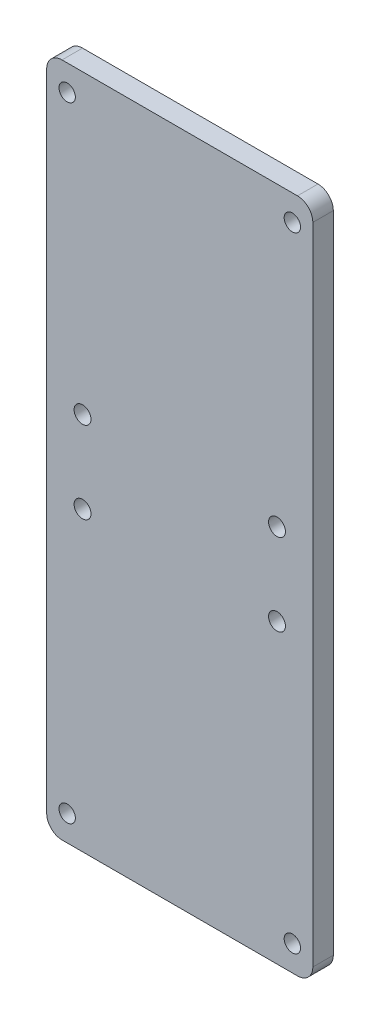
from build123d import *

# Parameters (mm, degrees)
SKETCH1_R           = 1.65
SKETCH1_R_2         = 1.6
BOSS_EXTRUDE1_DEPTH = 4


with BuildPart() as part:
    # Sketch1 → Boss-Extrude1 (new body)
    with BuildSketch(Plane.XY):
        with BuildLine():
            Line((23.206941284, 124.936391703), (23.206941284, -1.063608297))
            ThreePointArc((23.206941284, -1.063608297), (24.085620941, -3.184928641), (26.206941284, -4.063608297))
            Line((26.206941284, -4.063608297), (72.208519176, -4.063608297))
            ThreePointArc((72.208519176, -4.063608297), (74.32983952, -3.184928641), (75.208519176, -1.063608297))
            Line((75.208519176, -1.063608297), (75.208519176, 124.936391703))
            ThreePointArc((75.208519176, 124.936391703), (74.32983952, 127.057712046), (72.208519176, 127.936391703))
            Line((72.208519176, 127.936391703), (26.206941284, 127.936391703))
            ThreePointArc((26.206941284, 127.936391703), (24.085620941, 127.057712046), (23.206941284, 124.936391703))
        make_face()
        with Locations((30.20773023, 53.936391703)):
            Circle(SKETCH1_R, mode=Mode.SUBTRACT)
        with Locations((27.206941284, 0.936391703)):
            Circle(SKETCH1_R_2, mode=Mode.SUBTRACT)
        with Locations((68.20773023, 69.936391703)):
            Circle(SKETCH1_R, mode=Mode.SUBTRACT)
        with Locations((71.208519176, 122.936391703)):
            Circle(SKETCH1_R_2, mode=Mode.SUBTRACT)
        with Locations((71.208519176, 0.936391703)):
            Circle(SKETCH1_R_2, mode=Mode.SUBTRACT)
        with Locations((68.20773023, 53.936391703)):
            Circle(SKETCH1_R, mode=Mode.SUBTRACT)
        with Locations((27.206941284, 122.936391703)):
            Circle(SKETCH1_R_2, mode=Mode.SUBTRACT)
        with Locations((30.20773023, 69.936391703)):
            Circle(SKETCH1_R, mode=Mode.SUBTRACT)
    extrude(amount=BOSS_EXTRUDE1_DEPTH)


solid = part.part
